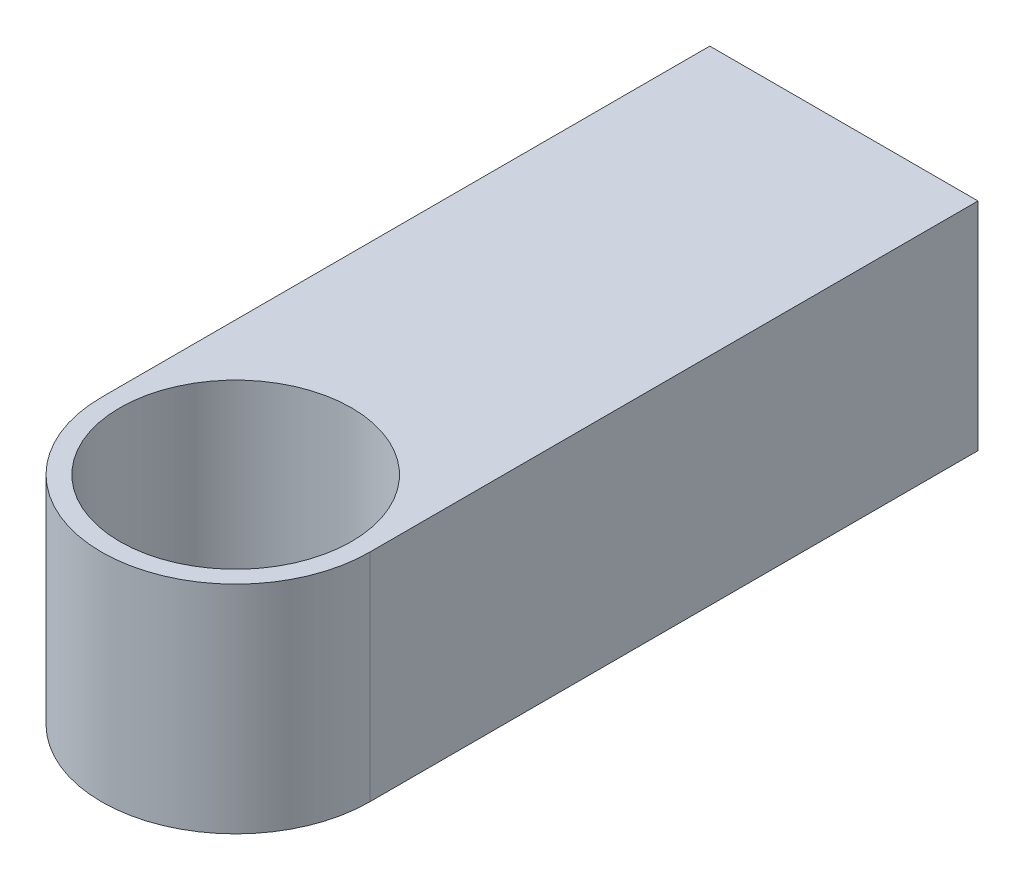
from build123d import *

# Parameters (mm, degrees)
BOSS_EXTRUDE3_REACH             = 37.896
BOSS_EXTRUDE3_DIRECTION_2_REACH = 37.896


with BuildPart() as part:
    # Sketch1 → Revolve2 (revolve)
    with BuildSketch(Plane.XY):
        Polygon((0, 0), (22.05, 0), (22.05, 35.56), (19.05, 35.56), (19.05, 3), (3, 3), (0, 3), align=None)
    revolve(axis=Axis((0, 35.56, 0), (0, -1, 0)))

    # Boss-Extrude3: up to this face of the body (flat: up to its plane)
    boss_extrude3_end = Plane(part.part.faces().sort_by_distance((0, 0, 0))[0])
    # Sketch5 → Boss-Extrude3 (add, up to the picked face)
    with BuildSketch(Plane(origin=(0, 17.78, 0), x_dir=(-1, 0, 0), z_dir=(0, -1, 0)), mode=Mode.PRIVATE) as boss_extrude3_sk1:
        with BuildLine():
            Line((22.05, 0), (22.05, 100))
            Line((22.05, 100), (-22.05, 100))
            Line((-22.05, 100), (-22.05, 0))
            ThreePointArc((-22.05, 0), (0, 22.05), (22.05, 0))
        make_face()
    boss_extrude3_tool1 = split(extrude(boss_extrude3_sk1.sketch, amount=BOSS_EXTRUDE3_REACH, mode=Mode.PRIVATE), bisect_by=boss_extrude3_end, keep=Keep.BOTH, mode=Mode.PRIVATE)
    add(boss_extrude3_tool1.solids().sort_by(Axis((0, 17.78, -58.512545), (0, -1, 0)))[0])

    # Boss-Extrude3 direction 2: up to this face of the body (flat: up to its plane)
    boss_extrude3_direction_2_end = Plane(part.part.faces().sort_by_distance((-21.426331819, 35.56, 0))[0])
    # Sketch5 → Boss-Extrude3 direction 2 (add, up to the picked face)
    with BuildSketch(Plane(origin=(0, 17.78, 0), x_dir=(-1, 0, 0), z_dir=(0, -1, 0)), mode=Mode.PRIVATE) as boss_extrude3_direction_2_sk1:
        with BuildLine():
            Line((22.05, 0), (22.05, 100))
            Line((22.05, 100), (-22.05, 100))
            Line((-22.05, 100), (-22.05, 0))
            ThreePointArc((-22.05, 0), (0, 22.05), (22.05, 0))
        make_face()
    boss_extrude3_direction_2_tool1 = split(extrude(boss_extrude3_direction_2_sk1.sketch, amount=-BOSS_EXTRUDE3_DIRECTION_2_REACH, mode=Mode.PRIVATE), bisect_by=boss_extrude3_direction_2_end, keep=Keep.BOTH, mode=Mode.PRIVATE)
    add(boss_extrude3_direction_2_tool1.solids().sort_by(Axis((0, 17.78, -58.512545), (0, 1, 0)))[0])


solid = part.part
